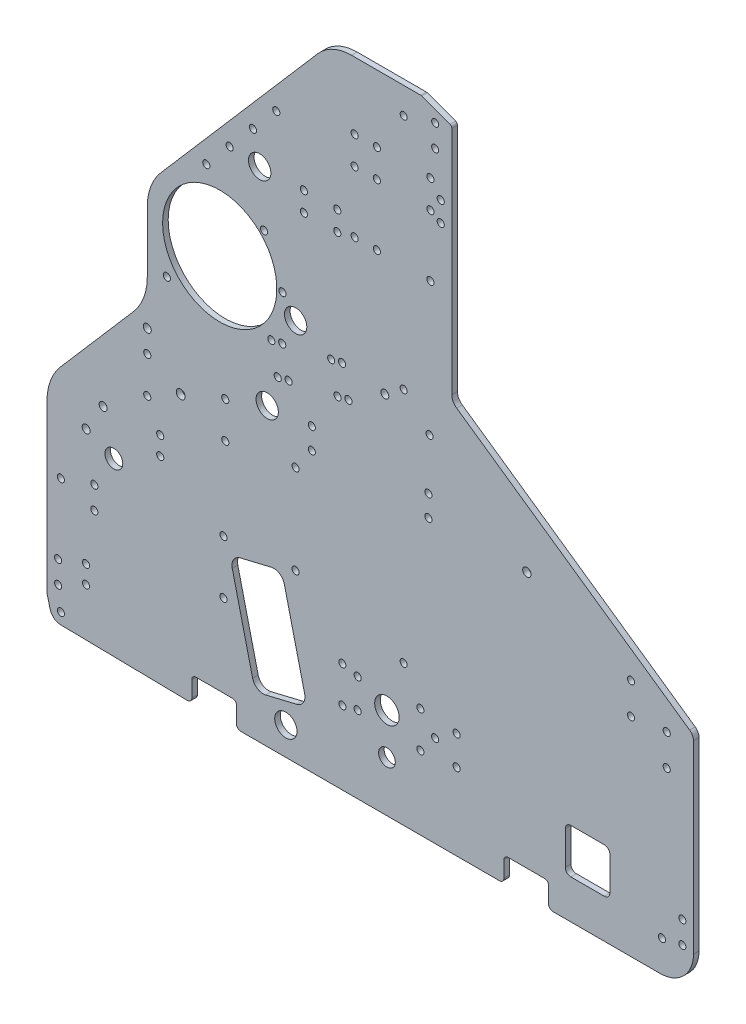
from build123d import *

# Parameters (mm, degrees)
SKETCH1_R           = 2.032
SKETCH1_R_2         = 5.08
SKETCH1_R_3         = 2.54
SKETCH1_R_4         = 6.35
SKETCH1_R_5         = 2
BOSS_EXTRUDE1_DEPTH = 3.175
FILLET1_R           = 2.286
FILLET2_R           = 6.35
SKETCH2_R           = 2.032
CUT_EXTRUDE1_DEPTH  = 505.524983177
FILLET3_R           = 1.5875
SKETCH3_R           = 6.35
SKETCH3_R_2         = 2.032
SKETCH3_R_3         = 2.286
CUT_EXTRUDE2_DEPTH  = 505.524983177
SKETCH4_R           = 2.032
SKETCH4_R_2         = 6.985
SKETCH4_R_3         = 4.7625
CUT_EXTRUDE3_DEPTH  = 505.524983177
SKETCH5_R           = 32.54375
SKETCH5_R_2         = 6.35
SKETCH5_R_3         = 2.39
CUT_EXTRUDE5_DEPTH  = 505.524983177
FILLET4_R           = 31.75
CUT_EXTRUDE6_DEPTH  = 505.524983177
FILLET5_R           = 25.4
SKETCH8_R           = 2.032000002
SKETCH8_R_2         = 2.031999999
SKETCH8_R_3         = 2.031999998
CUT_EXTRUDE7_DEPTH  = 505.524983177
SKETCH10_R          = 2.032
CUT_EXTRUDE8_DEPTH  = 505.524983177
SKETCH11_RX         = 2.032
SKETCH11_RY         = 2.031999502
CUT_EXTRUDE9_DEPTH  = 505.524983177
SKETCH12_R          = 2.032
CUT_EXTRUDE10_DEPTH = 505.524983319
SKETCH14_R          = 6.375981846
CUT_EXTRUDE11_DEPTH = 505.524983319
SKETCH15_R          = 2.286
SKETCH15_R_2        = 2.159
CUT_EXTRUDE12_DEPTH = 505.524983319
FILLET7_R           = 5.08
FILLET8_R           = 2.54
SKETCH17_R          = 2.032
CUT_EXTRUDE13_DEPTH = 505.524983319
FILLET9_R           = 19.05


with BuildPart() as part:
    # Sketch1 → Boss-Extrude1 (new body)
    with BuildSketch(Plane.XY):
        with BuildLine():
            Line((7.829508682, -19.049081656), (82.55, -20.32))
            Line((82.55, -20.32), (82.55, -6.35))
            Line((82.55, -6.35), (107.95, -6.35))
            Line((107.95, -6.35), (107.95, -20.32))
            Line((107.95, -20.32), (260.35, -20.32))
            Line((260.35, -20.32), (260.35, -6.35))
            Line((260.35, -6.35), (285.75, -6.35))
            Line((285.75, -6.35), (285.75, -20.32))
            Line((285.75, -20.32), (368.3, -20.32))
            Line((368.3, -20.32), (368.3, 106.68))
            Line((368.3, 106.68), (230.66375, 202.565))
            Line((230.66375, 202.565), (230.66375, 338.455))
            Line((230.66375, 338.455), (213.19998, 344.805))
            Line((213.19998, 344.805), (203.2, 344.805))
            Line((203.2, 344.805), (161.925, 344.805))
            Line((161.925, 344.805), (52.720122664, 218.469945827))
            ThreePointArc((52.720122664, 218.469945827), (52.803835479, 218.142145922), (52.832, 217.805))
            ThreePointArc((52.832, 217.805), (52.095493096, 216.239521914), (50.419872403, 215.808871996))
            Line((50.419872403, 215.808871996), (0, 157.48))
            Line((0, 157.48), (0, 0))
            Line((0, 0), (0, -6.35))
            ThreePointArc((0, -6.35), (0.047577015, -7.125863724), (0.189595124, -7.890101219))
            Line((0.189595124, -7.890101219), (1.777095124, -14.240101219))
            ThreePointArc((1.777095124, -14.240101219), (3.987212552, -17.671692778), (7.829508682, -19.049081656))
        make_face()
        with Locations((7.9375, -12.7)):
            Circle(SKETCH1_R, mode=Mode.SUBTRACT)
        with Locations((6.35, 0)):
            Circle(SKETCH1_R, mode=Mode.SUBTRACT)
        with Locations((6.35, 12.7)):
            Circle(SKETCH1_R, mode=Mode.SUBTRACT)
        with Locations((38.1, 78.105)):
            Circle(SKETCH1_R_2, mode=Mode.SUBTRACT)
        with Locations((57.15, 118.58625)):
            Circle(SKETCH1_R, mode=Mode.SUBTRACT)
        with Locations((57.15, 139.22375)):
            Circle(SKETCH1_R, mode=Mode.SUBTRACT)
        with Locations((76.2, 128.905)):
            Circle(SKETCH1_R_3, mode=Mode.SUBTRACT)
        with Locations((101.6, 118.58625)):
            Circle(SKETCH1_R, mode=Mode.SUBTRACT)
        with Locations((101.6, 139.22375)):
            Circle(SKETCH1_R, mode=Mode.SUBTRACT)
        with Locations((125.468192568, 147.91106164)):
            Circle(SKETCH1_R_4, mode=Mode.SUBTRACT)
        with Locations((203.2, 59.805)):
            Circle(SKETCH1_R_5, mode=Mode.SUBTRACT)
        with Locations((350.339487758, -2.359487758)):
            Circle(SKETCH1_R, mode=Mode.SUBTRACT)
        with Locations((361.95, 0)):
            Circle(SKETCH1_R, mode=Mode.SUBTRACT)
        with Locations((361.95, 12.7)):
            Circle(SKETCH1_R, mode=Mode.SUBTRACT)
        with Locations((353.06, 82.955052336)):
            Circle(SKETCH1_R, mode=Mode.SUBTRACT)
        with Locations((332.74, 98.195052336)):
            Circle(SKETCH1_R, mode=Mode.SUBTRACT)
        with Locations((332.74, 115.975052336)):
            Circle(SKETCH1_R, mode=Mode.SUBTRACT)
        with Locations((353.06, 100.735052336)):
            Circle(SKETCH1_R, mode=Mode.SUBTRACT)
        with Locations((68.326, 182.923674932)):
            Circle(SKETCH1_R, mode=Mode.SUBTRACT)
        with Locations((76.2, 217.805)):
            Circle(SKETCH1_R, mode=Mode.SUBTRACT)
        with Locations((90.779500502, 249.682)):
            Circle(SKETCH1_R, mode=Mode.SUBTRACT)
        with Locations((104.067838673, 265.054783374)):
            Circle(SKETCH1_R, mode=Mode.SUBTRACT)
        with Locations((117.356176844, 280.427566748)):
            Circle(SKETCH1_R, mode=Mode.SUBTRACT)
        with Locations((130.644515014, 295.800350122)):
            Circle(SKETCH1_R, mode=Mode.SUBTRACT)
        with Locations((203.2, 194.805)):
            Circle(SKETCH1_R_5, mode=Mode.SUBTRACT)
        with Locations((224.31375, 287.401)):
            Circle(SKETCH1_R, mode=Mode.SUBTRACT)
        with Locations((224.31375, 298.831)):
            Circle(SKETCH1_R, mode=Mode.SUBTRACT)
        with Locations((203.2, 329.805)):
            Circle(SKETCH1_R_5, mode=Mode.SUBTRACT)
        with Locations((221.138115, 322.58)):
            Circle(SKETCH1_R_5, mode=Mode.SUBTRACT)
        with Locations((221.138115, 335.28)):
            Circle(SKETCH1_R_5, mode=Mode.SUBTRACT)
    extrude(amount=BOSS_EXTRUDE1_DEPTH)

    # Fillet1
    fillet1_edges = [part.edges().sort_by_distance(p)[0] for p in [
        (285.75, -6.35, 1.5875),
        (107.95, -6.35, 1.5875),
        (260.35, -6.35, 1.5875),
        (82.55, -6.35, 1.5875),
    ]]
    fillet(fillet1_edges, radius=FILLET1_R)

    # Fillet2
    fillet2_edges = [part.edges().sort_by_distance(p)[0] for p in [
        (230.66375, 202.565, 1.5875),
    ]]
    fillet(fillet2_edges, radius=FILLET2_R)

    # Sketch2 → Cut-Extrude1 (cut, through all)
    with BuildSketch(Plane(origin=(0, 0, 0), x_dir=(-1, 0, 0), z_dir=(0, 0, -1))):
        with Locations((-100.552770272, 71.086035298)):
            Circle(SKETCH2_R)
        with Locations((-100.552770272, 40.606035298)):
            Circle(SKETCH2_R)
        with Locations((-22.225, 18.202541089)):
            Circle(SKETCH2_R)
        with Locations((-22.225, 8.042541089)):
            Circle(SKETCH2_R)
    extrude(amount=-CUT_EXTRUDE1_DEPTH, mode=Mode.SUBTRACT)

    # Fillet3
    fillet3_edges = [part.edges().sort_by_distance(p)[0] for p in [
        (230.66375, 338.455, 1.5875),
        (213.19998, 344.805, 1.5875),
    ]]
    fillet(fillet3_edges, radius=FILLET3_R)

    # Sketch3 → Cut-Extrude2 (cut, through all)
    with BuildSketch(Plane.XY.offset(3.175)):
        with BuildLine():
            Line((127.789350211, 69.359774106), (110.090750339, 65.117184968))
            ThreePointArc((110.090750339, 65.117184968), (106.287939856, 62.356288953), (105.55119507, 57.715047577))
            Line((105.55119507, 57.715047577), (117.160037875, 9.287010566))
            ThreePointArc((117.160037875, 9.287010566), (119.92093389, 5.484200083), (124.562175266, 4.747455297))
            Line((124.562175266, 4.747455297), (142.260775137, 8.990044434))
            ThreePointArc((142.260775137, 8.990044434), (146.063585621, 11.75094045), (146.800330407, 16.392181825))
            Line((146.800330407, 16.392181825), (135.191487602, 64.820218836))
            ThreePointArc((135.191487602, 64.820218836), (132.430591586, 68.62302932), (127.789350211, 69.359774106))
        make_face()
        with Locations((136.094563167, -4.324155877)):
            Circle(SKETCH3_R)
        with Locations((26.987500002, 46.953113935)):
            Circle(SKETCH3_R_2)
        with Locations((26.987500002, 59.653113935)):
            Circle(SKETCH3_R_2)
        with Locations((7.937500002, 53.303113935)):
            Circle(SKETCH3_R_2)
        with Locations((32.030600949, 100.810868853)):
            Circle(SKETCH3_R_3)
        with Locations((64.525942114, 102.94048958)):
            Circle(SKETCH3_R_2)
        with Locations((64.525942114, 92.525786339)):
            Circle(SKETCH3_R_2)
        with Locations((134.14375, 208.228121768)):
            Circle(SKETCH3_R_2)
        with Locations((123.681970341, 233.485092108)):
            Circle(SKETCH3_R_2)
    extrude(amount=-CUT_EXTRUDE2_DEPTH, mode=Mode.SUBTRACT)

    # Sketch4 → Cut-Extrude3 (cut, through all)
    with BuildSketch(Plane.XY.offset(3.175)):
        with Locations((168.275, 42.06875)):
            Circle(SKETCH4_R)
        with Locations((212.725, 42.06875)):
            Circle(SKETCH4_R)
        with Locations((212.725, 21.43125)):
            Circle(SKETCH4_R)
        with Locations((168.275, 21.43125)):
            Circle(SKETCH4_R)
        with Locations((193.675, 31.75)):
            Circle(SKETCH4_R_2)
        with Locations((177.00498, 40.0431)):
            Circle(SKETCH4_R)
        with Locations((177.00498, 23.4569)):
            Circle(SKETCH4_R)
        with Locations((193.675, 8.466666658)):
            Circle(SKETCH4_R_3)
        with Locations((221.138115, 31.75)):
            Circle(SKETCH4_R)
        with Locations((233.36123, 23.4569)):
            Circle(SKETCH4_R)
        with Locations((233.36123, 40.0431)):
            Circle(SKETCH4_R)
    extrude(amount=-CUT_EXTRUDE3_DEPTH, mode=Mode.SUBTRACT)

    # Sketch5 → Cut-Extrude5 (cut, through all)
    with BuildSketch(Plane(origin=(0, 0, 0), x_dir=(-1, 0, 0), z_dir=(0, 0, -1))):
        Polygon((0, 157.48), (-57.15, 223.594705882), (-57.15, 165.333696112), (0, 99.218990229), align=None)
        with Locations((-98.425, 208.228121768)):
            Circle(SKETCH5_R)
        with Locations((-141.675587431, 197.971943782)):
            Circle(SKETCH5_R_2)
        with Locations((-273.397487287, 139.729072186)):
            Circle(SKETCH5_R_3)
    extrude(amount=-CUT_EXTRUDE5_DEPTH, mode=Mode.SUBTRACT)

    # Fillet4
    fillet4_edges = [part.edges().sort_by_distance(p)[0] for p in [
        (0, 99.218990229, 1.5875),
        (57.15, 165.333696112, 1.5875),
        (57.15, 223.594705882, 1.5875),
    ]]
    fillet(fillet4_edges, radius=FILLET4_R)

    # Sketch6 → Cut-Extrude6 (cut, through all)
    with BuildSketch(Plane.XY.offset(3.175)):
        with BuildLine():
            Line((298.45, 27.305), (317.5, 27.305))
            ThreePointArc((317.5, 27.305), (319.74506403, 26.37506403), (320.675, 24.13))
            Line((320.675, 24.13), (320.675, 5.08))
            ThreePointArc((320.675, 5.08), (319.74506403, 2.83493597), (317.5, 1.905))
            Line((317.5, 1.905), (298.45, 1.905))
            ThreePointArc((298.45, 1.905), (296.20493597, 2.83493597), (295.275, 5.08))
            Line((295.275, 5.08), (295.275, 24.13))
            ThreePointArc((295.275, 24.13), (296.20493597, 26.37506403), (298.45, 27.305))
        make_face()
    extrude(amount=-CUT_EXTRUDE6_DEPTH, mode=Mode.SUBTRACT)

    # Fillet5
    fillet5_edges = [part.edges().sort_by_distance(p)[0] for p in [
        (161.925, 344.805, 1.5875),
    ]]
    fillet(fillet5_edges, radius=FILLET5_R)

    # Sketch8 → Cut-Extrude7 (cut, through all)
    with BuildSketch(Plane(origin=(0, 0, 0), x_dir=(-1, 0, 0), z_dir=(0, 0, -1))):
        with Locations((-218.44, 290.83)):
            Circle(SKETCH8_R)
        with Locations((-187.96, 290.83)):
            Circle(SKETCH8_R)
        with Locations((-187.96, 306.70500001)):
            Circle(SKETCH8_R_2)
        with Locations((-175.26, 290.83)):
            Circle(SKETCH8_R)
        with Locations((-187.96, 255.905)):
            Circle(SKETCH8_R)
        with Locations((-218.44, 306.70500001)):
            Circle(SKETCH8_R_3)
        with Locations((-175.26, 306.70500001)):
            Circle(SKETCH8_R_2)
        with Locations((-175.26, 255.905)):
            Circle(SKETCH8_R)
        with Locations((-218.44, 255.905)):
            Circle(SKETCH8_R)
    extrude(amount=-CUT_EXTRUDE7_DEPTH, mode=Mode.SUBTRACT)

    # Sketch10 → Cut-Extrude8 (cut, through all)
    with BuildSketch(Plane.XY.offset(3.175)):
        with Locations((141.64248, 74.684371768)):
            Circle(SKETCH10_R)
        with Locations((141.64248, 125.484371768)):
            Circle(SKETCH10_R)
    extrude(amount=-CUT_EXTRUDE8_DEPTH, mode=Mode.SUBTRACT)

    # Sketch11 → Cut-Extrude9 (cut, through all)
    with BuildSketch(Plane.XY.offset(3.175)):
        with Locations(Location((150.881424454, 138.43), (0, 0, 90))):
            Ellipse(SKETCH11_RX, SKETCH11_RY)
        with Locations(Location((150.881424454, 150.495), (0, 0, 90))):
            Ellipse(SKETCH11_RX, SKETCH11_RY)
        with Locations(Location((217.30240818, 150.495), (0, 0, 90))):
            Ellipse(SKETCH11_RX, SKETCH11_RY)
        with Locations(Location((217.30240818, 138.43), (0, 0, 90))):
            Ellipse(SKETCH11_RX, SKETCH11_RY)
    extrude(amount=-CUT_EXTRUDE9_DEPTH, mode=Mode.SUBTRACT)

    # Sketch12 → Cut-Extrude10 (cut, through all)
    with BuildSketch(Plane(origin=(0, 0, 0), x_dir=(-1, 0, 0), z_dir=(0, 0, -1))):
        with Locations((-165.4175, 264.63498)):
            Circle(SKETCH12_R)
        with Locations((-165.4175, 253.52248)):
            Circle(SKETCH12_R)
        with Locations((-146.3675, 253.52248)):
            Circle(SKETCH12_R)
        with Locations((-146.3675, 264.63498)):
            Circle(SKETCH12_R)
    extrude(amount=-CUT_EXTRUDE10_DEPTH, mode=Mode.SUBTRACT)

    # Sketch14 → Cut-Extrude11 (cut, through all)
    with BuildSketch(Plane(origin=(0, 0, 0), x_dir=(-1, 0, 0), z_dir=(0, 0, -1))):
        with Locations((-121.184716432, 263.688494682)):
            Circle(SKETCH14_R)
    extrude(amount=-CUT_EXTRUDE11_DEPTH, mode=Mode.SUBTRACT)

    # Sketch15 → Cut-Extrude12 (cut, through all)
    with BuildSketch(Plane.XY.offset(3.175)):
        with Locations((57.149999598, 151.92375)):
            Circle(SKETCH15_R)
        with Locations((192.439038553, 187.119947783)):
            Circle(SKETCH15_R)
        with Locations((38.100000402, 78.105)):
            Circle(SKETCH15_R_2)
        with Locations((22.359447929, 84.872674248)):
            Circle(SKETCH15_R)
        with BuildLine():
            ThreePointArc((163.873740193, 173.680575348), (163.573171964, 172.102507308), (164.512499663, 170.799317578))
            ThreePointArc((164.512499663, 170.799317578), (167.540838937, 172.982117899), (163.873740193, 173.680575348))
        make_face()
        with BuildLine():
            ThreePointArc((173.439750352, 172.778441408), (173.740318582, 174.356509448), (172.800990882, 175.659699178))
            ThreePointArc((172.800990882, 175.659699178), (169.772651609, 173.476898857), (173.439750352, 172.778441408))
        make_face()
        with BuildLine():
            ThreePointArc((169.158853279, 192.088320238), (166.130514005, 189.905519917), (169.797612748, 189.207062468))
            ThreePointArc((169.797612748, 189.207062468), (170.098180978, 190.785130508), (169.158853279, 192.088320238))
        make_face()
        with BuildLine():
            ThreePointArc((160.23160259, 190.109196408), (159.93103436, 188.531128368), (160.870362059, 187.227938638))
            ThreePointArc((160.870362059, 187.227938638), (163.898701333, 189.410738959), (160.23160259, 190.109196408))
        make_face()
        with BuildLine():
            ThreePointArc((129.776602145, 166.121421832), (129.476033915, 164.543353791), (130.415361614, 163.240164061))
            ThreePointArc((130.415361614, 163.240164061), (133.443700888, 165.422964383), (129.776602145, 166.121421832))
        make_face()
        with BuildLine():
            ThreePointArc((139.342612303, 165.219287891), (139.643180533, 166.797355931), (138.703852834, 168.100545661))
            ThreePointArc((138.703852834, 168.100545661), (135.67551356, 165.91774534), (139.342612303, 165.219287891))
        make_face()
        with BuildLine():
            ThreePointArc((135.7004747, 181.647908951), (136.00104293, 183.225976991), (135.06171523, 184.529166721))
            ThreePointArc((135.06171523, 184.529166721), (132.033375957, 182.3463664), (135.7004747, 181.647908951))
        make_face()
        with BuildLine():
            ThreePointArc((126.134464541, 182.550042891), (125.833896311, 180.971974851), (126.773224011, 179.668785121))
            ThreePointArc((126.773224011, 179.668785121), (129.801563284, 181.851585442), (126.134464541, 182.550042891))
        make_face()
    extrude(amount=-CUT_EXTRUDE12_DEPTH, mode=Mode.SUBTRACT)

    # Fillet7
    fillet7_edges = [part.edges().sort_by_distance(p)[0] for p in [
        (368.3, 106.68, 1.5875),
    ]]
    fillet(fillet7_edges, radius=FILLET7_R)

    # Fillet8
    fillet8_edges = [part.edges().sort_by_distance(p)[0] for p in [
        (82.55, -20.32, 1.5875),
        (107.95, -20.32, 1.5875),
        (260.35, -20.32, 1.5875),
        (285.75, -20.32, 1.5875),
    ]]
    fillet(fillet8_edges, radius=FILLET8_R)

    # Sketch17 → Cut-Extrude13 (cut, through all)
    with BuildSketch(Plane.XY.offset(3.175)):
        with Locations((217.96375, 179.705)):
            Circle(SKETCH17_R)
    extrude(amount=-CUT_EXTRUDE13_DEPTH, mode=Mode.SUBTRACT)

    # Fillet9
    fillet9_edges = [part.edges().sort_by_distance(p)[0] for p in [
        (368.3, -20.32, 1.5875),
    ]]
    fillet(fillet9_edges, radius=FILLET9_R)


solid = part.part
